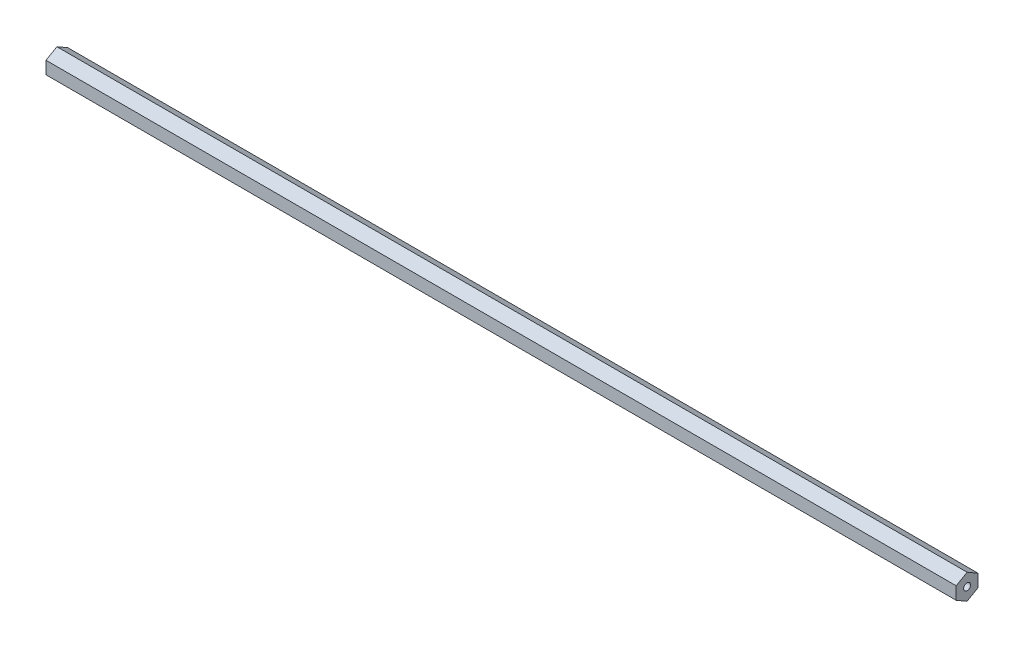
from build123d import *

# Parameters (mm, degrees)
BOSS_EXTRUDE1_DEPTH        = 265.1125
F_10_32_TAPPED_HOLE1_D     = 4.0386
F_10_32_TAPPED_HOLE1_DEPTH = 12.0396
F_10_32_TAPPED_HOLE1_TIP   = 1.213317848
F_10_32_TAPPED_HOLE2_D     = 4.0386
F_10_32_TAPPED_HOLE2_DEPTH = 12.0396
F_10_32_TAPPED_HOLE2_TIP   = 1.213317848


with BuildPart() as part:
    # Sketch1 → Boss-Extrude1 (new, symmetric)
    with BuildSketch(Plane(origin=(0, 0, 0), x_dir=(0, 0, -1), z_dir=(1, 0, 0))):
        Polygon((0, 7.332348419), (-6.35, 3.666174209), (-6.35, -3.666174209), (0, -7.332348419), (6.35, -3.666174209), (6.35, 3.666174209), align=None)
    extrude(amount=BOSS_EXTRUDE1_DEPTH, both=True)

    # #10-32 Tapped Hole1
    with Locations(Plane(origin=(265.1125, 0, 0), x_dir=(0, 0, -1), z_dir=(1, 0, 0))):
        with Locations((0, 0)):
            Hole(F_10_32_TAPPED_HOLE1_D / 2, depth=F_10_32_TAPPED_HOLE1_DEPTH)
            with Locations((0, 0, -(F_10_32_TAPPED_HOLE1_DEPTH + F_10_32_TAPPED_HOLE1_TIP / 2))):  # 118° drill point
                Cone(0, F_10_32_TAPPED_HOLE1_D / 2, F_10_32_TAPPED_HOLE1_TIP, mode=Mode.SUBTRACT)

    # #10-32 Tapped Hole2
    with Locations(Plane.ZY.offset(265.1125)):
        with Locations((0, 0)):
            Hole(F_10_32_TAPPED_HOLE2_D / 2, depth=F_10_32_TAPPED_HOLE2_DEPTH)
            with Locations((0, 0, -(F_10_32_TAPPED_HOLE2_DEPTH + F_10_32_TAPPED_HOLE2_TIP / 2))):  # 118° drill point
                Cone(0, F_10_32_TAPPED_HOLE2_D / 2, F_10_32_TAPPED_HOLE2_TIP, mode=Mode.SUBTRACT)


solid = part.part
